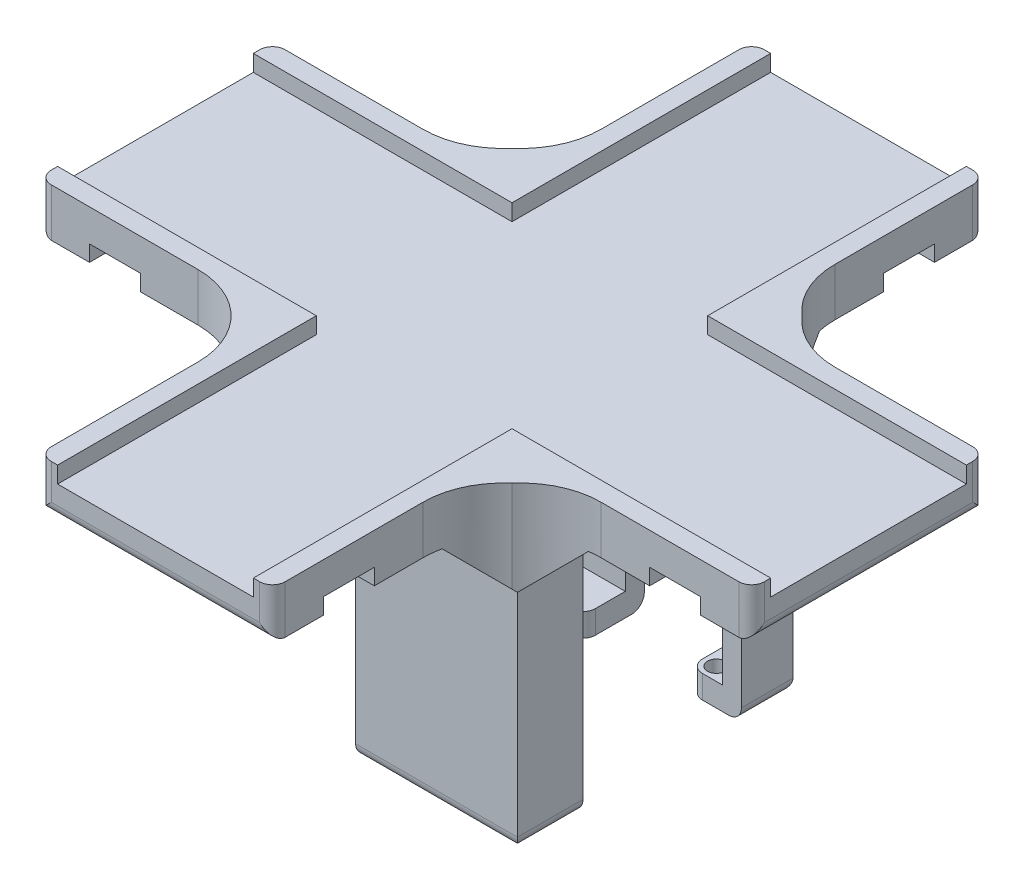
from build123d import *

# Parameters (mm, degrees)
SKETCH1_W           = 29.1625
SKETCH1_H           = 29.86875
SKETCH1_W_2         = 29.86875
SKETCH1_H_2         = 29.1625
BOSS_EXTRUDE1_DEPTH = 3
CUT_EXTRUDE1_DEPTH  = 2.05000004
SKETCH3_W           = 14
SKETCH3_H           = 4.5
SKETCH3_W_2         = 3.25
SKETCH3_H_2         = 3.25
SKETCH3_R           = 1.1
SKETCH3_W_3         = 17
SKETCH3_H_3         = 5
BOSS_EXTRUDE2_DEPTH = 2.88
SKETCH6_W           = 3.500000112
SKETCH6_H           = 3.500000112
BOSS_EXTRUDE3_DEPTH = 6
SKETCH4_W           = 17.175
SKETCH4_H           = 2.375
BOSS_EXTRUDE4_DEPTH = 31.5
FILLET1_R           = 10
CHAMFER1_SIZE       = 6.35
FILLET2_R           = 1.5875
FILLET3_R           = 1.5875
SKETCH7_W           = 29.1625
SKETCH7_H           = 6.35
SKETCH7_W_2         = 6.35
SKETCH7_H_2         = 29.1625
CUT_EXTRUDE2_DEPTH  = 2
FILLET4_R           = 1.5875


with BuildPart() as part:
    # Sketch1 → Boss-Extrude1 (new, symmetric)
    with BuildSketch(Plane(origin=(0, 0, 0), x_dir=(1, 0, 0), z_dir=(0, 1, 0))):
        with Locations((0, -29.515625)):
            Rectangle(SKETCH1_W, SKETCH1_H)
        with Locations((-29.515625, 0)):
            Rectangle(SKETCH1_W_2, SKETCH1_H_2)
        Rectangle(SKETCH1_W, SKETCH1_H_2)
        with Locations((0, 29.515625)):
            Rectangle(SKETCH1_W, SKETCH1_H)
        with Locations((29.515625, 0)):
            Rectangle(SKETCH1_W_2, SKETCH1_H_2)
    extrude(amount=BOSS_EXTRUDE1_DEPTH, both=True)

    # Sketch2 → Cut-Extrude1 (cut)
    with BuildSketch(Plane(origin=(0, 3, 0), x_dir=(1, 0, 0), z_dir=(0, 1, 0))):
        Polygon((12.2, -44.45), (12.2, -12.2), (44.45, -12.2), (44.45, 12.2), (12.2, 12.2), (12.2, 44.45), (-12.2, 44.45), (-12.2, 12.2), (-44.45, 12.2), (-44.45, -12.2), (-12.2, -12.2), (-12.2, -44.45), align=None)
    extrude(amount=-CUT_EXTRUDE1_DEPTH, mode=Mode.SUBTRACT)

    # Sketch6 → Boss-Extrude3 (add)
    with BuildSketch(Plane(origin=(0, -3, 0), x_dir=(-1, 0, 0), z_dir=(0, -1, 0))):
        with Locations((-16.331250056, -16.331250056)):
            Rectangle(SKETCH6_W, SKETCH6_H)
        with Locations((-16.331250056, 16.331250056)):
            Rectangle(SKETCH6_W, SKETCH6_H)
        with Locations((16.331250056, 16.331250056)):
            Rectangle(SKETCH6_W, SKETCH6_H)
    extrude(amount=-BOSS_EXTRUDE3_DEPTH)



with BuildPart() as body_2:
    # Sketch3 → Boss-Extrude2 (new body)
    # profile 1 of 6: a face of its own
    with BuildSketch(Plane.XZ.offset(34.5)):
        Polygon((-17.855, -9.5), (-17.855, -17.175), (-0.68, -17.175), (-0.68, -14), (-14.68, -14), (-14.68, -9.5), align=None)
    # profile 2 of 6: a face of its own
    with BuildSketch(Plane.XZ.offset(34.5)):
        with Locations((-7.68, -11.75)):
            Rectangle(SKETCH3_W, SKETCH3_H)
    # profile 3 of 6: a face of its own
    with BuildSketch(Plane.XZ.offset(34.5)):
        Polygon((14.68, -14), (11.43, -14), (11.43, -17.175), (17.855, -17.175), (17.855, -10.75), (14.68, -10.75), align=None)
    # profile 4 of 6: a face of its own
    with BuildSketch(Plane.XZ.offset(34.5)):
        with Locations((13.055, -12.375)):
            Rectangle(SKETCH3_W_2, SKETCH3_H_2)
        with Locations(Location((13.08, -12.4, 0), (0, 0, 90))):
            Circle(SKETCH3_R, mode=Mode.SUBTRACT)
    # profile 5 of 6: a face of its own
    with BuildSketch(Plane.XZ.offset(34.5)):
        with Locations((6.18, 11.5)):
            Rectangle(SKETCH3_W_3, SKETCH3_H_3)
        with Locations(Location((13.08, 12.4, 0), (0, 0, 90))):
            Circle(SKETCH3_R, mode=Mode.SUBTRACT)
    # profile 6 of 6: a face of its own
    with BuildSketch(Plane.XZ.offset(34.5)):
        Polygon((-2.32, 17.175), (-2.32, 14), (14.68, 14), (14.68, 9), (17.855, 9), (17.855, 17.175), align=None)
    extrude(amount=BOSS_EXTRUDE2_DEPTH)


with BuildPart() as part_1:
    add(part.part)

    add(body_2.part)  # Boss-Extrude4 merges body 2
    # Sketch4 → Boss-Extrude4 (add)
    with BuildSketch(Plane(origin=(0, -34.5, 0), x_dir=(1, 0, 0), z_dir=(0, 1, 0))):
        Polygon((15.48, 10.75), (15.48, 14.8), (11.43, 14.8), (11.43, 17.175), (17.855, 17.175), (17.855, 10.75), align=None)
        Polygon((17.855, -9), (15.48, -9), (15.48, -14.8), (-2.32, -14.8), (-2.32, -17.175), (17.855, -17.175), align=None)
        with Locations((-9.2675, 15.9875)):
            Rectangle(SKETCH4_W, SKETCH4_H)
    extrude(amount=BOSS_EXTRUDE4_DEPTH)

    # Fillet1
    # the kernel refuses this fillet: 10 mm, written as the material it adds along each edge
    with BuildSketch(Plane(origin=(-14.58125, -3, 14.58125), x_dir=(-1, 0, 0), z_dir=(0, 1, 0))) as fillet1_piece_1:
        with BuildLine():
            CenterArc((FILLET1_R, FILLET1_R), FILLET1_R, 180, 90)
            Line((0, FILLET1_R), (-FILLET1_R * 0.02, FILLET1_R))
            Line((-FILLET1_R * 0.02, FILLET1_R), (-FILLET1_R * 0.02, -FILLET1_R * 0.02))
            Line((-FILLET1_R * 0.02, -FILLET1_R * 0.02), (FILLET1_R, -FILLET1_R * 0.02))
            Line((FILLET1_R, -FILLET1_R * 0.02), (FILLET1_R, 0))
        make_face()
    extrude(amount=6)
    with BuildSketch(Plane(origin=(-14.58125, -3, -18.081250112), x_dir=(0, 0, -1), z_dir=(0, 1, 0))) as fillet1_piece_2:
        with BuildLine():
            CenterArc((7.599342173, 10), FILLET1_R, 220.541601029, 49.458398971)
            Line((0, 3.500000112), (-0.151986843, 3.370000114))
            ThreePointArc((-0.151986843, 3.370000114), (-0.2, 1.750000056), (-0.2, 0))
            Line((-0.2, 0), (0, -0.2))
            Line((0, -0.2), (7.599342173, -0.2))
            Line((7.599342173, -0.2), (7.599342173, 0))
        make_face()
    extrude(amount=6)
    with BuildSketch(Plane(origin=(-18.081250112, -3, -14.58125), x_dir=(0, 0, -1), z_dir=(0, 1, 0)), Plane(origin=(14.58125, -3, -18.081250112), x_dir=(1, 0, 0), z_dir=(0, 1, 0))) as fillet1_piece_3:
        with BuildLine():
            CenterArc((10, 7.599342173), FILLET1_R, 180, 49.458398971)
            Line((0, 7.599342173), (-0.2, 7.599342173))
            Line((-0.2, 7.599342173), (-0.2, 0))
            Line((-0.2, 0), (0, -0.2))
            ThreePointArc((0, -0.2), (1.750000056, -0.2), (3.370000114, -0.151986843))
            Line((3.370000114, -0.151986843), (3.500000112, 0))
        make_face()
    extrude(amount=6)
    with BuildSketch(Plane(origin=(18.081250112, -3, -14.58125), x_dir=(0, 0, -1), z_dir=(0, 1, 0)), Plane(origin=(14.58125, -3, 18.081250112), x_dir=(1, 0, 0), z_dir=(0, 1, 0))) as fillet1_piece_4:
        with BuildLine():
            CenterArc((10, -7.599342173), FILLET1_R, 130.541601029, 49.458398971)
            Line((0, -7.599342173), (-0.2, -7.599342173))
            Line((-0.2, -7.599342173), (-0.2, 0))
            Line((-0.2, 0), (0, 0.2))
            ThreePointArc((0, 0.2), (1.750000056, 0.2), (3.370000114, 0.151986843))
            Line((3.370000114, 0.151986843), (3.500000112, 0))
        make_face()
    extrude(amount=6)
    with BuildSketch(Plane(origin=(18.081250112, -3, 14.58125), x_dir=(1, 0, 0), z_dir=(0, 1, 0))) as fillet1_piece_5:
        with BuildLine():
            CenterArc((7.599342173, -10), FILLET1_R, 90, 49.458398971)
            Line((0, -3.500000112), (-0.151986843, -3.370000114))
            ThreePointArc((-0.151986843, -3.370000114), (-0.2, -1.750000056), (-0.2, 0))
            Line((-0.2, 0), (0, 0.2))
            Line((0, 0.2), (7.599342173, 0.2))
            Line((7.599342173, 0.2), (7.599342173, 0))
        make_face()
    extrude(amount=6)

    # Chamfer1
    # the kernel refuses this chamfer: 6.35 mm, written as the material it adds along each edge
    with BuildSketch(Plane(origin=(-2.32, -3, 17.175), x_dir=(0, 0, 1), z_dir=(1, 0, 0))) as chamfer1_piece_1_section:
        Polygon((CHAMFER1_SIZE, 0), (0, CHAMFER1_SIZE), (0, 0), align=None)
    chamfer1_piece_1 = extrude(amount=36.505186974, mode=Mode.PRIVATE)
    chamfer1_piece_1 = chamfer1_piece_1 - Plane(origin=(25.680592285, -3, 24.58125), x_dir=(1, 0, 0), z_dir=(0, -1, 0)) * Cylinder(10, 99, mode=Mode.PRIVATE)
    chamfer1_piece_1 = chamfer1_piece_1 - Plane(origin=(24.58125, -3, 25.680592285), x_dir=(1, 0, 0), z_dir=(0, -1, 0)) * Cylinder(10, 99, mode=Mode.PRIVATE)
    chamfer1_piece_1 = split(chamfer1_piece_1, bisect_by=Plane(origin=(10.9425, -16.2625, 17.175), z_dir=(-0.7071067811865478, 0.7071067811865475, 0)), keep=Keep.TOP, mode=Mode.PRIVATE)
    add(chamfer1_piece_1)
    with BuildSketch(Plane(origin=(17.855, -3, 33.505186974), x_dir=(1, 0, 0), z_dir=(0, 0, -1))) as chamfer1_piece_2_section:
        Polygon((CHAMFER1_SIZE, 0), (0, CHAMFER1_SIZE), (0, 0), align=None)
    chamfer1_piece_2 = extrude(amount=24.505186974, mode=Mode.PRIVATE)
    chamfer1_piece_2 = chamfer1_piece_2 - Plane(origin=(25.680592285, -3, 24.58125), x_dir=(1, 0, 0), z_dir=(0, -1, 0)) * Cylinder(10, 75, mode=Mode.PRIVATE)
    chamfer1_piece_2 = chamfer1_piece_2 - Plane(origin=(24.58125, -3, 25.680592285), x_dir=(1, 0, 0), z_dir=(0, -1, 0)) * Cylinder(10, 75, mode=Mode.PRIVATE)
    chamfer1_piece_2 = split(chamfer1_piece_2, bisect_by=Plane(origin=(17.855, 1.990093487, 28.515093487), z_dir=(0, 0.7071067811865475, -0.7071067811865478)), keep=Keep.TOP, mode=Mode.PRIVATE)
    add(chamfer1_piece_2)
    with BuildSketch(Plane(origin=(-34.185186974, -3, -17.175), x_dir=(0, 0, -1), z_dir=(1, 0, 0))) as chamfer1_piece_3_section:
        Polygon((CHAMFER1_SIZE, 0), (0, -CHAMFER1_SIZE), (0, 0), align=None)
    chamfer1_piece_3 = extrude(amount=33.505186974, mode=Mode.PRIVATE)
    chamfer1_piece_3 = chamfer1_piece_3 - Plane(origin=(-24.58125, -3, -25.680592285), x_dir=(0, 0, -1), z_dir=(0, -1, 0)) * Cylinder(10, 93, mode=Mode.PRIVATE)
    chamfer1_piece_3 = chamfer1_piece_3 - Plane(origin=(-25.680592285, -3, -24.58125), x_dir=(0, 0, -1), z_dir=(0, -1, 0)) * Cylinder(10, 93, mode=Mode.PRIVATE)
    chamfer1_piece_3 = split(chamfer1_piece_3, bisect_by=Plane(origin=(-29.195093487, 1.990093487, -17.175), z_dir=(0.7071067811865476, 0.7071067811865476, 0)), keep=Keep.TOP, mode=Mode.PRIVATE)
    add(chamfer1_piece_3)
    with BuildSketch(Plane(origin=(-34.185186974, -3, -17.175), x_dir=(0, 0, -1), z_dir=(1, 0, 0))) as chamfer1_piece_4_section:
        Polygon((CHAMFER1_SIZE, 0), (0, -CHAMFER1_SIZE), (0, 0), align=None)
    chamfer1_piece_4 = extrude(amount=49.835373947, mode=Mode.PRIVATE)
    chamfer1_piece_4 = chamfer1_piece_4 - Plane(origin=(24.58125, -3, -25.680592285), x_dir=(1, 0, 0), z_dir=(0, -1, 0)) * Cylinder(10, 126, mode=Mode.PRIVATE)
    chamfer1_piece_4 = split(chamfer1_piece_4, bisect_by=Plane(origin=(11.43, -3, -17.175), z_dir=(1, 0, 0)), keep=Keep.TOP, mode=Mode.PRIVATE)
    add(chamfer1_piece_4)
    with BuildSketch(Plane(origin=(-17.855, -3, -14.8), x_dir=(-1, 0, 0), z_dir=(0, 0, -1))) as chamfer1_piece_5_section:
        Polygon((CHAMFER1_SIZE, 0), (0, -CHAMFER1_SIZE), (0, 0), align=None)
    chamfer1_piece_5 = extrude(amount=18.705186974, mode=Mode.PRIVATE)
    chamfer1_piece_5 = chamfer1_piece_5 - Plane(origin=(-24.58125, -3, -25.680592285), x_dir=(0, 0, -1), z_dir=(0, -1, 0)) * Cylinder(10, 63, mode=Mode.PRIVATE)
    chamfer1_piece_5 = chamfer1_piece_5 - Plane(origin=(-25.680592285, -3, -24.58125), x_dir=(0, 0, -1), z_dir=(0, -1, 0)) * Cylinder(10, 63, mode=Mode.PRIVATE)
    chamfer1_piece_5 = split(chamfer1_piece_5, bisect_by=Plane(origin=(-17.855, -7.3625, -19.1625), z_dir=(0, 0.7071067811865475, 0.7071067811865478)), keep=Keep.TOP, mode=Mode.PRIVATE)
    add(chamfer1_piece_5)
    with BuildSketch(Plane(origin=(-4.900186974, -3, -17.175), x_dir=(0, 0, -1), z_dir=(1, 0, 0))) as chamfer1_piece_6_section:
        Polygon((CHAMFER1_SIZE, 0), (0, -CHAMFER1_SIZE), (0, 0), align=None)
    chamfer1_piece_6 = extrude(amount=39.085373947, mode=Mode.PRIVATE)
    chamfer1_piece_6 = split(chamfer1_piece_6, bisect_by=Plane(origin=(-0.68, -3, -17.175), z_dir=(-1, 0, 0)), keep=Keep.TOP, mode=Mode.PRIVATE)
    add(chamfer1_piece_6)
    with BuildSketch(Plane(origin=(11.43, -3, -17.175), x_dir=(0, 0, -1), z_dir=(1, 0, 0))) as chamfer1_piece_7_section:
        Polygon((CHAMFER1_SIZE, 0), (0, -CHAMFER1_SIZE), (0, 0), align=None)
    chamfer1_piece_7 = extrude(amount=22.755186974, mode=Mode.PRIVATE)
    chamfer1_piece_7 = chamfer1_piece_7 - Plane(origin=(24.58125, -3, -25.680592285), x_dir=(1, 0, 0), z_dir=(0, -1, 0)) * Cylinder(10, 71, mode=Mode.PRIVATE)
    chamfer1_piece_7 = chamfer1_piece_7 - Plane(origin=(25.680592285, -3, -24.58125), x_dir=(0, 0, -1), z_dir=(0, -1, 0)) * Cylinder(10, 71, mode=Mode.PRIVATE)
    chamfer1_piece_7 = split(chamfer1_piece_7, bisect_by=Plane(origin=(17.8175, -9.3875, -17.175), z_dir=(-0.7071067811865476, 0.7071067811865476, 0)), keep=Keep.TOP, mode=Mode.PRIVATE)
    add(chamfer1_piece_7)
    with BuildSketch(Plane(origin=(17.855, -3, -33.505186974), x_dir=(1, 0, 0), z_dir=(0, 0, 1))) as chamfer1_piece_8_section:
        Polygon((CHAMFER1_SIZE, 0), (0, -CHAMFER1_SIZE), (0, 0), align=None)
    chamfer1_piece_8 = extrude(amount=22.755186974, mode=Mode.PRIVATE)
    chamfer1_piece_8 = chamfer1_piece_8 - Plane(origin=(24.58125, -3, -25.680592285), x_dir=(1, 0, 0), z_dir=(0, -1, 0)) * Cylinder(10, 71, mode=Mode.PRIVATE)
    chamfer1_piece_8 = chamfer1_piece_8 - Plane(origin=(25.680592285, -3, -24.58125), x_dir=(0, 0, -1), z_dir=(0, -1, 0)) * Cylinder(10, 71, mode=Mode.PRIVATE)
    chamfer1_piece_8 = split(chamfer1_piece_8, bisect_by=Plane(origin=(17.855, 1.990093487, -28.515093487), z_dir=(0, 0.7071067811865475, 0.7071067811865478)), keep=Keep.TOP, mode=Mode.PRIVATE)
    add(chamfer1_piece_8)

    # Fillet2
    fillet2_edges = [part_1.edges().sort_by_distance(p)[0] for p in [
        (-0.68, -35.94, -9.5),
        (-2.32, -35.94, 9),
        (11.43, -35.94, -10.75),
        (-17.855, -35.94, -9.5),
    ]]
    fillet(fillet2_edges, radius=FILLET2_R)

    # Fillet3
    fillet3_edges = [part_1.edges().sort_by_distance(p)[0] for p in [
        (17.855, -37.38, 13.0875),
        (7.7675, -37.38, 17.175),
        (-9.2675, -37.38, -17.175),
        (14.6425, -37.38, -17.175),
        (17.855, -37.38, -13.9625),
    ]]
    fillet(fillet3_edges, radius=FILLET3_R)

    # Sketch7 → Cut-Extrude2 (cut)
    with BuildSketch(Plane(origin=(0, -3, 0), x_dir=(-1, 0, 0), z_dir=(0, -1, 0))):
        with Locations((0, -34.925)):
            Rectangle(SKETCH7_W, SKETCH7_H)
        with Locations((-34.925, 0)):
            Rectangle(SKETCH7_W_2, SKETCH7_H_2)
        with Locations((0, 34.925)):
            Rectangle(SKETCH7_W, SKETCH7_H)
        with Locations((34.925, 0)):
            Rectangle(SKETCH7_W_2, SKETCH7_H_2)
    extrude(amount=-CUT_EXTRUDE2_DEPTH, mode=Mode.SUBTRACT)

    # Fillet4
    fillet4_edges = [part_1.edges().sort_by_distance(p)[0] for p in [
        (14.58125, 0, 44.45),
        (44.45, 0, 14.58125),
        (44.45, -3, 0),
        (44.45, 0, -14.58125),
        (14.58125, 0, -44.45),
        (-14.58125, 0, -44.45),
        (-44.45, 0, -14.58125),
        (-44.45, 0, 14.58125),
        (-14.58125, 0, 44.45),
        (0, -3, 44.45),
        (-44.45, -3, 0),
        (0, -3, -44.45),
    ]]
    fillet(fillet4_edges, radius=FILLET4_R)


solid = part_1.part
